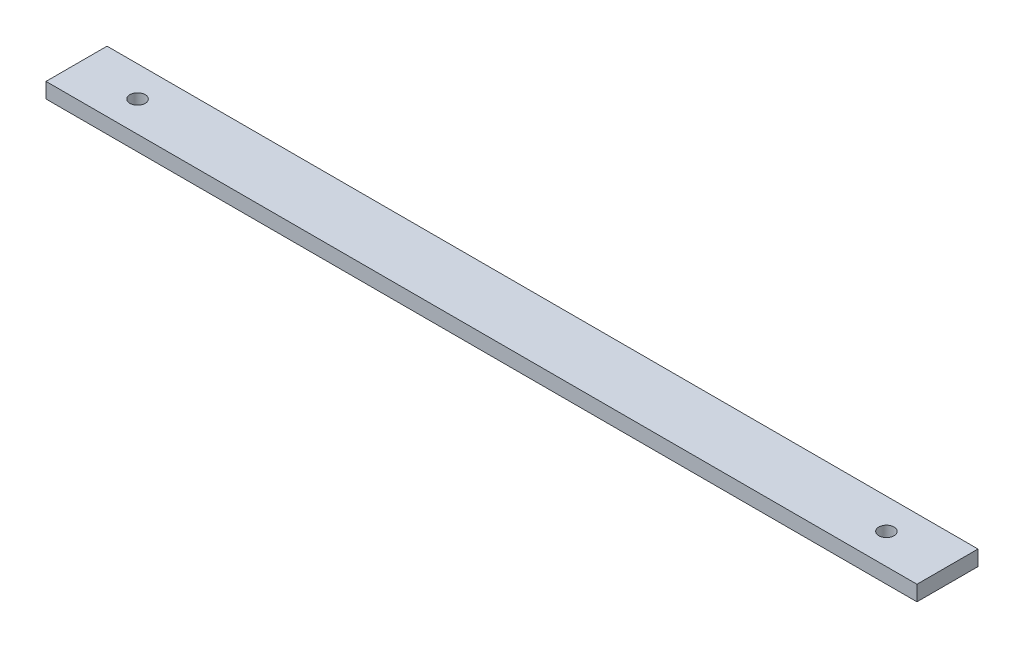
from build123d import *

# Parameters (mm, degrees)
SKETCH1_W           = 362.445554
SKETCH1_H           = 25.4
BOSS_EXTRUDE1_DEPTH = 6.35
CUT_EXTRUDE1_REACH  = 365.39
SKETCH2_R           = 3.175


with BuildPart() as part:
    # Sketch1 → Boss-Extrude1 (new body)
    with BuildSketch(Plane(origin=(0, 0, 0), x_dir=(1, 0, 0), z_dir=(0, 1, 0))):
        with Locations((181.222777, -12.7)):
            Rectangle(SKETCH1_W, SKETCH1_H)
    extrude(amount=BOSS_EXTRUDE1_DEPTH)

    # Sketch2 → Cut-Extrude1 (cut, up to next)
    with BuildSketch(Plane.XZ, mode=Mode.PRIVATE) as cut_extrude1_sk1:
        with Locations((25.4, 12.7)):
            Circle(SKETCH2_R)
    cut_extrude1_tool1 = extrude(cut_extrude1_sk1.sketch, amount=-CUT_EXTRUDE1_REACH, mode=Mode.PRIVATE) & part.part
    # Sketch2 → Cut-Extrude1 (cut, up to next)
    with BuildSketch(Plane.XZ, mode=Mode.PRIVATE) as cut_extrude1_sk2:
        with Locations((337.045554, 12.7)):
            Circle(SKETCH2_R)
    cut_extrude1_tool2 = extrude(cut_extrude1_sk2.sketch, amount=-CUT_EXTRUDE1_REACH, mode=Mode.PRIVATE) & part.part
    add(cut_extrude1_tool1.solids().sort_by_distance((25.4, 0, 12.7))[0], mode=Mode.SUBTRACT)
    add(cut_extrude1_tool2.solids().sort_by_distance((337.045554, 0, 12.7))[0], mode=Mode.SUBTRACT)


solid = part.part
